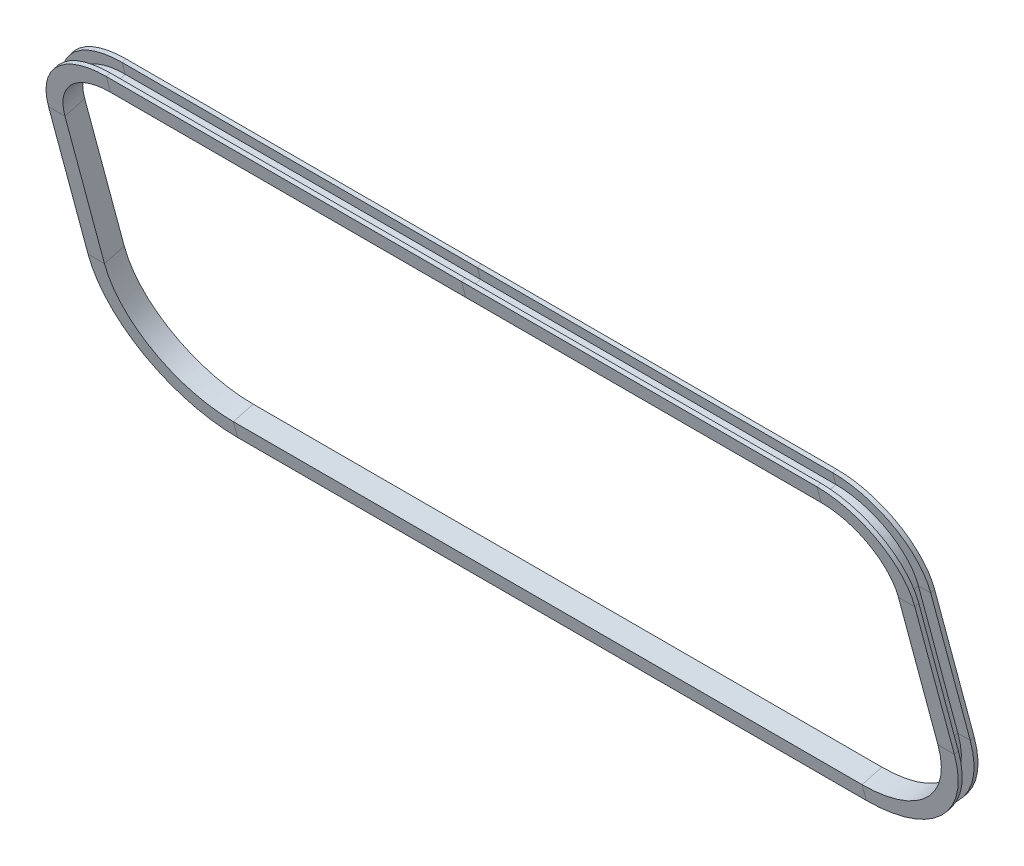
from build123d import *


with BuildPart() as part:
    # Sweep3: sweep along a path in Sketch3
    with BuildLine(Plane(origin=(0, 1.985571585, -7.410254038), x_dir=(1, 0, 0), z_dir=(0, -0.25881904510252146, 0.9659258262890681))) as sweep3_path:
        Line((101.75, 13.631023018), (101.75, -23.643043085))
        ThreePointArc((101.75, -23.643043085), (94.42766953, -41.320712615), (76.75, -48.643043085))
        Line((76.75, -48.643043085), (-76.75, -48.643043085))
        ThreePointArc((-76.75, -48.643043085), (-94.42766953, -41.320712615), (-101.75, -23.643043085))
        Line((-101.75, -23.643043085), (-101.75, 13.631023018))
        ThreePointArc((-101.75, 13.631023018), (-97.356601718, 24.237624736), (-86.75, 28.631023018))
        Line((-86.75, 28.631023018), (86.75, 28.631023018))
        ThreePointArc((86.75, 28.631023018), (97.356601718, 24.237624736), (101.75, 13.631023018))
    # Sketch6 → Sweep3 (sweep)
    with BuildSketch(Plane(origin=(0, 0, 0), x_dir=(0, 0, -1), z_dir=(1, 0, 0))):
        Polygon((-1.03527618, 33.504719457), (0, 29.641016151), (-4.829629131, 28.346920926), (-5.864905312, 32.210624231), (-4.898979486, 32.469443276), (-4.12252235, 29.571665797), (-1.224744871, 30.348122933), (-2.001202007, 33.245900411), align=None)
    sweep(path=sweep3_path.line)


solid = part.part
